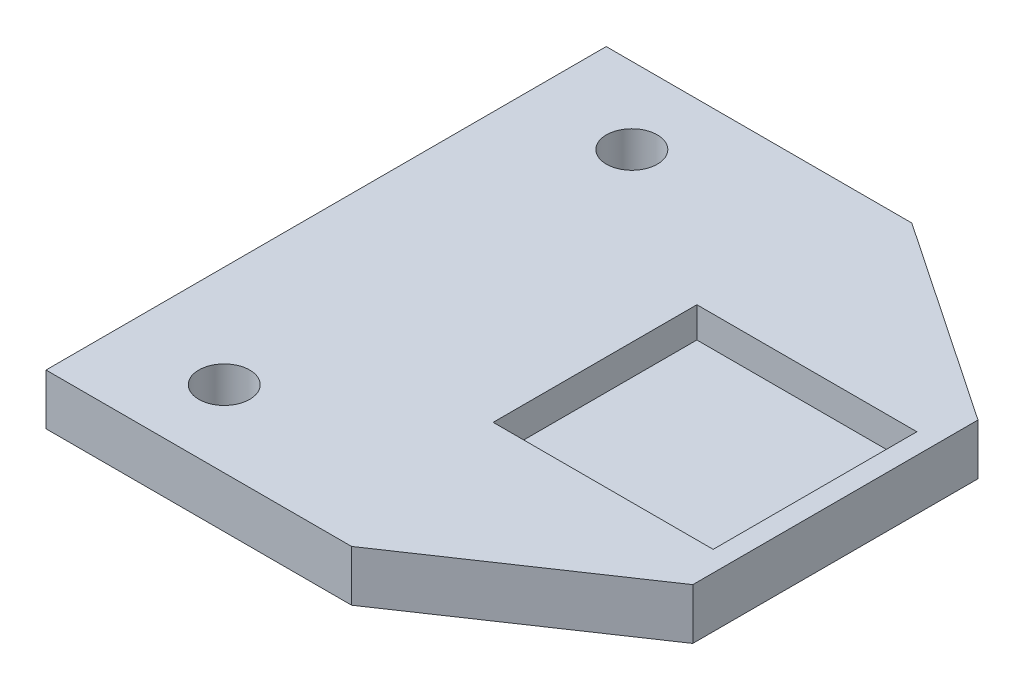
from build123d import *

# Parameters (mm, degrees)
SKETCH1_R           = 3.175
BOSS_EXTRUDE1_DEPTH = 6.35
SKETCH2_W           = 27.432
SKETCH2_H           = 25.4
CUT_EXTRUDE1_DEPTH  = 3.81


with BuildPart() as part:
    # Sketch1 → Boss-Extrude1 (new body)
    with BuildSketch(Plane(origin=(0, 0, 0), x_dir=(1, 0, 0), z_dir=(0, 1, 0))):
        Polygon((25.4, -9.525), (50.8, 7.62), (50.8, 43.18), (25.4, 60.325), (-12.7, 60.325), (-12.7, -9.525), align=None)
        with Locations((0.015945784, 50.804705025)):
            Circle(SKETCH1_R, mode=Mode.SUBTRACT)
        Circle(SKETCH1_R, mode=Mode.SUBTRACT)
    extrude(amount=BOSS_EXTRUDE1_DEPTH)

    # Sketch2 → Cut-Extrude1 (cut)
    with BuildSketch(Plane(origin=(0, 6.35, 0), x_dir=(1, 0, 0), z_dir=(0, 1, 0))):
        with Locations((34.544, 25.4)):
            Rectangle(SKETCH2_W, SKETCH2_H)
    extrude(amount=-CUT_EXTRUDE1_DEPTH, mode=Mode.SUBTRACT)


solid = part.part
